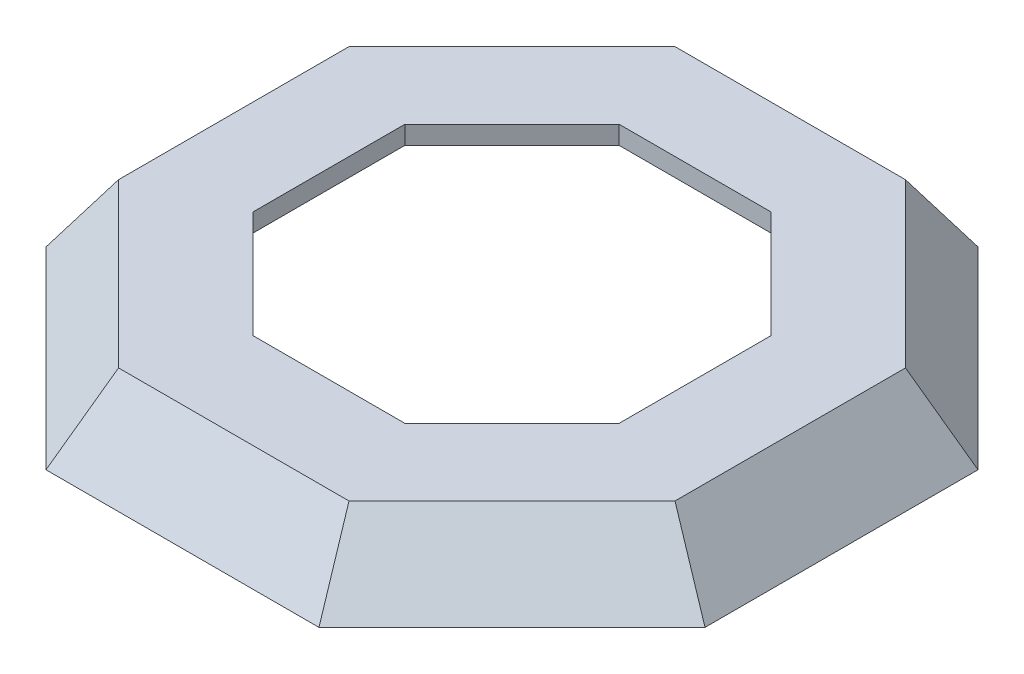
from build123d import *
from OCP.BRepFilletAPI import BRepFilletAPI_MakeChamfer

# Parameters (mm, degrees)
BOSS_EXTRUDE1_DEPTH = 20
CHAMFER1_SIZE       = 20
CHAMFER1_SIZE_2     = 14.004150764
SHELL1_DEPTH        = 15
SHELL1_DRAFT        = 35
CUT_EXTRUDE2_DEPTH  = 129.840987267


# Read off the part's stored shape, not the designer's step: Shell1
with BuildPart() as part:
    # Sketch1 → Boss-Extrude1 (new body)
    with BuildSketch(Plane(origin=(0, 0, 0), x_dir=(1, 0, 0), z_dir=(0, 1, 0))):
        Polygon((90, -37.279220614), (90, 37.279220614), (37.279220614, 90), (-37.279220614, 90), (-90, 37.279220614), (-90, -37.279220614), (-37.279220614, -90), (37.279220614, -90), align=None)
    extrude(amount=BOSS_EXTRUDE1_DEPTH)

    # Chamfer1
    chamfer1_edges_1 = [part.edges().sort_by_distance(p)[0] for p in [
        (0, 20, 90),
    ]]
    chamfer1_side_1 = [part.faces().sort_by_distance(p)[0] for p in [
        (0, 19.719916985, 90),
    ]]
    chamfer1_edges_2 = [part.edges().sort_by_distance(p)[0] for p in [
        (-63.639610307, 20, 63.639610307),
    ]]
    chamfer1_side_2 = [part.faces().sort_by_distance(p)[0] for p in [
        (-63.639610307, 19.719916985, 63.639610307),
    ]]
    chamfer1_edges_3 = [part.edges().sort_by_distance(p)[0] for p in [
        (-90, 20, 0),
    ]]
    chamfer1_side_3 = [part.faces().sort_by_distance(p)[0] for p in [
        (-90, 19.719916985, 0),
    ]]
    chamfer1_edges_4 = [part.edges().sort_by_distance(p)[0] for p in [
        (-63.639610307, 20, -63.639610307),
    ]]
    chamfer1_side_4 = [part.faces().sort_by_distance(p)[0] for p in [
        (-63.639610307, 19.719916985, -63.639610307),
    ]]
    chamfer1_edges_5 = [part.edges().sort_by_distance(p)[0] for p in [
        (0, 20, -90),
    ]]
    chamfer1_side_5 = [part.faces().sort_by_distance(p)[0] for p in [
        (0, 19.719916985, -90),
    ]]
    chamfer1_edges_6 = [part.edges().sort_by_distance(p)[0] for p in [
        (63.639610307, 20, -63.639610307),
    ]]
    chamfer1_side_6 = [part.faces().sort_by_distance(p)[0] for p in [
        (63.639610307, 19.719916985, -63.639610307),
    ]]
    chamfer1_edges_7 = [part.edges().sort_by_distance(p)[0] for p in [
        (90, 20, 0),
    ]]
    chamfer1_side_7 = [part.faces().sort_by_distance(p)[0] for p in [
        (90, 19.719916985, 0),
    ]]
    chamfer1_edges_8 = [part.edges().sort_by_distance(p)[0] for p in [
        (63.639610307, 20, 63.639610307),
    ]]
    chamfer1_side_8 = [part.faces().sort_by_distance(p)[0] for p in [
        (63.639610307, 19.719916985, 63.639610307),
    ]]
    chamfer1 = BRepFilletAPI_MakeChamfer(part.part.solid().wrapped)
    for e in chamfer1_edges_1:
        chamfer1.Add(CHAMFER1_SIZE - 0.0001, CHAMFER1_SIZE_2 - 0.0001, e.wrapped, chamfer1_side_1[0].wrapped)
    for e in chamfer1_edges_2:
        chamfer1.Add(CHAMFER1_SIZE - 0.0001, CHAMFER1_SIZE_2 - 0.0001, e.wrapped, chamfer1_side_2[0].wrapped)
    for e in chamfer1_edges_3:
        chamfer1.Add(CHAMFER1_SIZE - 0.0001, CHAMFER1_SIZE_2 - 0.0001, e.wrapped, chamfer1_side_3[0].wrapped)
    for e in chamfer1_edges_4:
        chamfer1.Add(CHAMFER1_SIZE - 0.0001, CHAMFER1_SIZE_2 - 0.0001, e.wrapped, chamfer1_side_4[0].wrapped)
    for e in chamfer1_edges_5:
        chamfer1.Add(CHAMFER1_SIZE - 0.0001, CHAMFER1_SIZE_2 - 0.0001, e.wrapped, chamfer1_side_5[0].wrapped)
    for e in chamfer1_edges_6:
        chamfer1.Add(CHAMFER1_SIZE - 0.0001, CHAMFER1_SIZE_2 - 0.0001, e.wrapped, chamfer1_side_6[0].wrapped)
    for e in chamfer1_edges_7:
        chamfer1.Add(CHAMFER1_SIZE - 0.0001, CHAMFER1_SIZE_2 - 0.0001, e.wrapped, chamfer1_side_7[0].wrapped)
    for e in chamfer1_edges_8:
        chamfer1.Add(CHAMFER1_SIZE - 0.0001, CHAMFER1_SIZE_2 - 0.0001, e.wrapped, chamfer1_side_8[0].wrapped)
    add(Compound.cast(chamfer1.Shape()), mode=Mode.REPLACE)  # a hair under: the kernel refuses the full size


with BuildPart() as shell1_tool:
    # Shell1 outline → Shell1 (with draft: the straight prism first)
    with BuildSketch(Plane(origin=(0, 15, 0), x_dir=(1, 0, 0), z_dir=(0, 1, 0))):
        Polygon((-30.400381775, -73.393013983), (30.400381775, -73.393013983), (73.393013983, -30.400381775), (73.393013983, 30.400381775), (30.400381775, 73.393013983), (-30.400381775, 73.393013983), (-73.393013983, 30.400381775), (-73.393013983, -30.400381775), align=None)
    extrude(amount=-SHELL1_DEPTH)
    # Shell1: the draft: its side faces are tilted about the plane it starts from
    shell1_sides = [shell1_tool.faces().sort_by_distance(p)[0] for p in [
        (0, 7.5, 73.393013983),
        (51.896697879, 7.5, 51.896697879),
        (73.393013983, 7.5, 0),
        (51.896697879, 7.5, -51.896697879),
        (0, 7.5, -73.393013983),
        (-51.896697879, 7.5, -51.896697879),
        (-73.393013983, 7.5, 0),
        (-51.896697879, 7.5, 51.896697879),
    ]]
    draft(shell1_sides, Plane(origin=(0, 15, 0), x_dir=(1, 0, 0), z_dir=(0, 1, 0)), SHELL1_DRAFT)


with BuildPart() as part_1:
    add(part.part)

    # Shell1: cut by shell1_tool
    add(shell1_tool.part, mode=Mode.SUBTRACT)

    # Sketch2 → Cut-Extrude2 (cut, through all)
    with BuildSketch(Plane(origin=(0, 20, 0), x_dir=(1, 0, 0), z_dir=(0, 1, 0))):
        Polygon((20.710678119, 50), (-20.710678119, 50), (-50, 20.710678119), (-50, -20.710678119), (-20.710678119, -50), (20.710678119, -50), (50, -20.710678119), (50, 20.710678119), align=None)
    extrude(amount=-CUT_EXTRUDE2_DEPTH, mode=Mode.SUBTRACT)


solid = part_1.part
